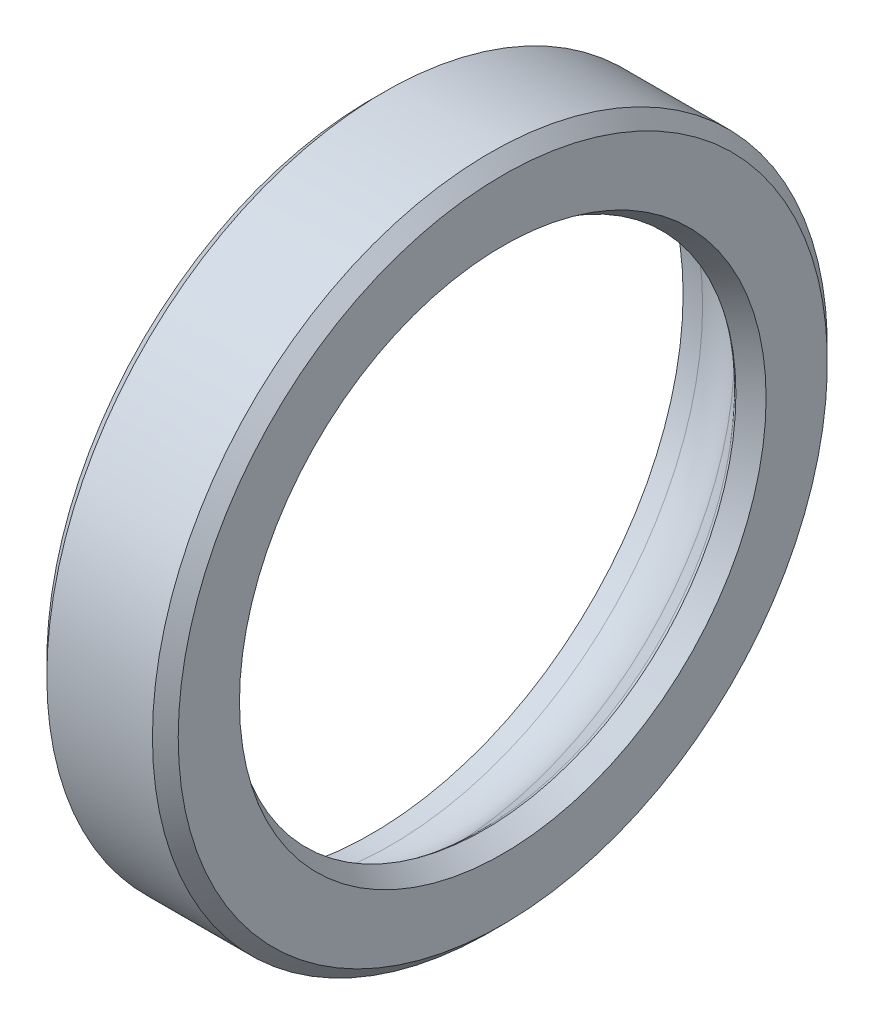
from build123d import *


with BuildPart() as part:
    # Çizim1 → Döndür1 (revolve)
    with BuildSketch(Plane.XY, mode=Mode.PRIVATE) as d_nd_r1_sk:
        with BuildLine():
            Line((0, 6.55), (0, 6.05))
            Line((0, 6.05), (0.378679656, 6.05))
            ThreePointArc((0.378679656, 6.05), (0.952704805, 5.935819299), (1.439339828, 5.610660172))
            Line((1.439339828, 5.610660172), (2.097487373, 4.952512627))
            ThreePointArc((2.097487373, 4.952512627), (2.211035546, 4.876642164), (2.344974747, 4.85))
            Line((2.344974747, 4.85), (2.55, 4.85))
            Line((2.55, 4.85), (2.55, 6.55))
            Line((2.55, 6.55), (0, 6.55))
        make_face()
    revolve(d_nd_r1_sk.sketch.rotate(Axis((0, 0, 0), (1, 0, 0)), 90), axis=Axis((0, 0, 0), (1, 0, 0)))

    # Pah1: read off the stored shape, not the designer's step
    # Pah1 outline → Pah1 (revolve, cut)
    with BuildSketch(Plane.YX):
        Polygon((4.887395483, 2.187563133), (5.110684424, 2.55), (4.85, 2.55), (4.85, 2.187563133), align=None)
        Polygon((6.55, 2.55), (6.3, 2.55), (6.55, 2.3), align=None)
        Polygon((6.55, 0), (6.55, 0.25), (6.3, 0), align=None)
    revolve(axis=Axis((0, 0, 0), (1, 0, 0)), mode=Mode.SUBTRACT)


solid = part.part
